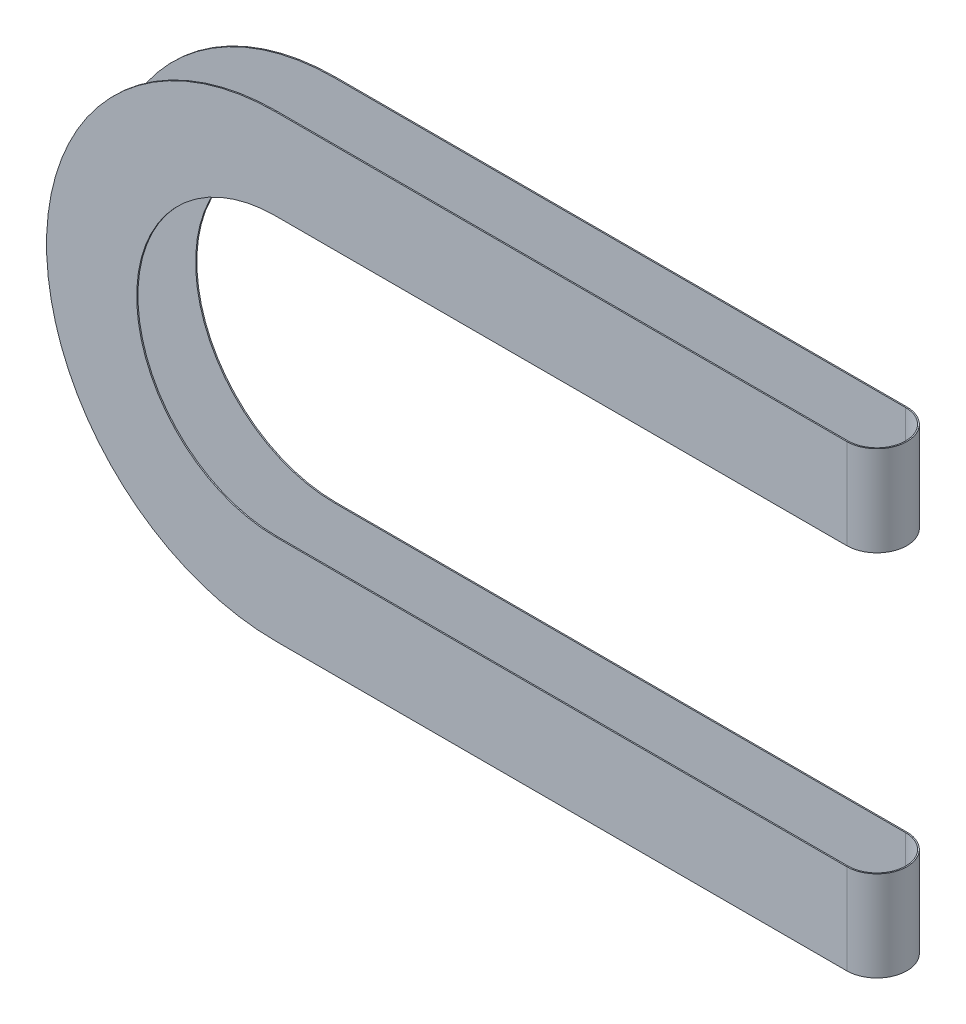
from build123d import *

# Parameters (mm, degrees)
EXTRUDE_1_DEPTH     = 100
CUT_EXTRUDE_1_DEPTH = 1000


with BuildPart() as part:
    # 草图1 → 凸台-拉伸1 (new body)
    with BuildSketch(Plane.XY):
        with BuildLine():
            Line((1000, -231.25), (0, -231.25))
            ThreePointArc((0, -231.25), (-231.25, 0), (0, 231.25))
            Line((0, 231.25), (1000, 231.25))
            Line((1000, 231.25), (1000, 381.25))
            Line((1000, 381.25), (0, 381.25))
            ThreePointArc((0, 381.25), (-381.25, 0), (0, -381.25))
            Line((0, -381.25), (1000, -381.25))
            Line((1000, -381.25), (1000, -231.25))
        make_face()
    extrude(amount=EXTRUDE_1_DEPTH)

    # 草图2 → 切除-拉伸1 (cut)
    with BuildSketch(Plane.XZ.offset(381.25)):
        with BuildLine():
            Line((-399.777797644, 98), (-399.777797644, 2))
            Line((-399.777797644, 2), (950, 2))
            ThreePointArc((950, 2), (998, 50), (950, 98))
            Line((950, 98), (-399.777797644, 98))
        make_face()
        with BuildLine():
            Line((1000, 100), (950, 100))
            ThreePointArc((950, 100), (985.355339059, 85.355339059), (1000, 50))
            Line((1000, 50), (1000, 100))
        make_face()
        with BuildLine():
            Line((1000, 0), (1000, 50))
            ThreePointArc((1000, 50), (985.355339059, 14.644660941), (950, 0))
            Line((950, 0), (1000, 0))
        make_face()
    extrude(amount=-CUT_EXTRUDE_1_DEPTH, mode=Mode.SUBTRACT)


solid = part.part
